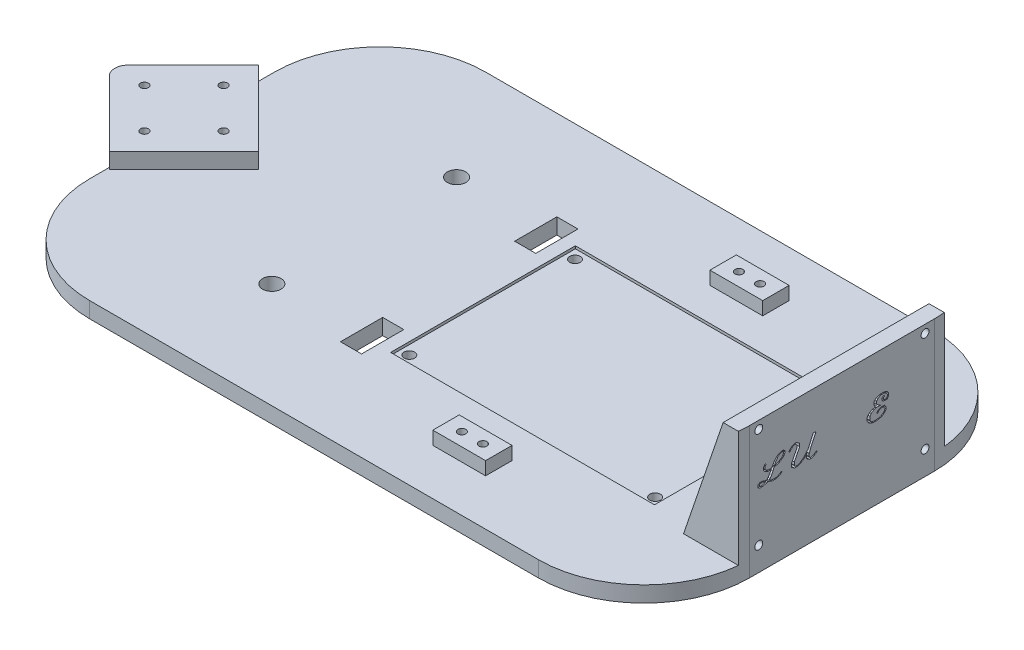
from build123d import *

# Parameters (mm, degrees)
SKETCH_1_W          = 250
SKETCH_1_H          = 150
EXTRUDE_1_DEPTH     = 6
SKETCH_2_W          = 78
SKETCH_2_H          = 44
EXTRUDE_2_DEPTH     = 6
SKETCH_3_W          = 15
SKETCH_3_H          = 70
CUT_EXTRUDE_2_DEPTH = 6
HOLE_WIZARD_M4_2_D  = 3
LOFT_START          = 36
LOFT_11_DEPTH       = 4
LOFT_START_2        = 110
LOFT_12_DEPTH       = 4
SKETCH_22_W         = 100
SKETCH_22_H         = 70
CUT_EXTRUDE_3_DEPTH = 1
HOLE_WIZARD_M5_1_D  = 4
HOLE_WIZARD_M8_1_D  = 7
SKETCH_30_W         = 20
SKETCH_30_H         = 10
EXTRUDE_3_DEPTH     = 5
SKETCH_31_R         = 1.5
CUT_EXTRUDE_4_DEPTH = 100
SKETCH_32_W         = 70
SKETCH_32_H         = 80
EXTRUDE_5_DEPTH     = 25
SKETCH_33_W         = 70
SKETCH_33_H         = 20
CUT_EXTRUDE_5_DEPTH = 65
LOFT_START_3        = 85
LOFT_13_DEPTH       = 10
SKETCH_43_W         = 8
SKETCH_43_H         = 16
CUT_EXTRUDE_6_DEPTH = 1000
EXTRUDE_6_DEPTH     = 6
SKETCH_46_R         = 1.5
CUT_EXTRUDE_7_DEPTH = 12
FILLET_1_R          = 40
FILLET_3_R          = 5
CUT_EXTRUDE_8_DEPTH = 2


# Read off the part's stored shape, not the designer's step: 放样11, 放样12, 放样13
with BuildPart() as part:
    # 草图1 → 凸台-拉伸1 (new body)
    with BuildSketch(Plane(origin=(0, 0, 0), x_dir=(1, 0, 0), z_dir=(0, 1, 0))):
        with Locations((125, -75)):
            Rectangle(SKETCH_1_W, SKETCH_1_H)
    extrude(amount=EXTRUDE_1_DEPTH)

    # 草图2 → 凸台-拉伸2 (add)
    with BuildSketch(Plane(origin=(250, 0, 0), x_dir=(0, 0, -1), z_dir=(1, 0, 0))):
        with Locations((-75, 28)):
            Rectangle(SKETCH_2_W, SKETCH_2_H)
    extrude(amount=-EXTRUDE_2_DEPTH)

    # 草图3 → 切除-拉伸2 (cut)
    with BuildSketch(Plane(origin=(0, 6, 0), x_dir=(1, 0, 0), z_dir=(0, 1, 0))):
        with Locations((236.5, -75)):
            Rectangle(SKETCH_3_W, SKETCH_3_H)
    extrude(amount=-CUT_EXTRUDE_2_DEPTH, mode=Mode.SUBTRACT)

    # M4 螺纹孔2 (through all)
    with Locations(Plane.ZY.offset(-244)):
        with Locations((43.5, 47), (43.5, 9), (106.5, 9), (106.5, 47)):
            Hole(HOLE_WIZARD_M4_2_D / 2)

    # 放样11 outline → 放样11 (add)
    with BuildSketch(Plane.XY.offset(LOFT_START)):
        Polygon((244, 6), (244, 50), (229, 6), align=None)
    extrude(amount=LOFT_11_DEPTH)

    # 放样12 outline → 放样12 (add)
    with BuildSketch(Plane.XY.offset(LOFT_START_2)):
        Polygon((244, 50), (229, 6), (244, 6), align=None)
    extrude(amount=LOFT_12_DEPTH)

    # 草图22 → 切除-拉伸3 (cut)
    with BuildSketch(Plane(origin=(0, 6, 0), x_dir=(1, 0, 0), z_dir=(0, 1, 0))):
        with Locations((164, -75)):
            Rectangle(SKETCH_22_W, SKETCH_22_H)
    extrude(amount=-CUT_EXTRUDE_3_DEPTH, mode=Mode.SUBTRACT)

    # M5 螺纹孔1 (through all)
    with Locations(Plane(origin=(0, 5, 0), x_dir=(1, 0, 0), z_dir=(0, 1, 0))):
        with Locations((117.39, -43.53), (210.34, -43.592), (117.423, -106.324), (210.599, -106.384)):
            Hole(HOLE_WIZARD_M5_1_D / 2)

    # M8 螺纹孔1 (through all)
    with Locations(Plane(origin=(0, 6, 0), x_dir=(1, 0, 0), z_dir=(0, 1, 0))):
        with Locations((69, -40), (69, -110)):
            Hole(HOLE_WIZARD_M8_1_D / 2)

    # 草图30 → 凸台-拉伸3 (add)
    with BuildSketch(Plane(origin=(0, 6, 0), x_dir=(1, 0, 0), z_dir=(0, 1, 0))):
        with Locations((162.5, -22.5)):
            Rectangle(SKETCH_30_W, SKETCH_30_H)
    extrude_3 = extrude(amount=EXTRUDE_3_DEPTH)

    # 草图31 → 切除-拉伸4 (cut)
    with BuildSketch(Plane(origin=(0, 11, 0), x_dir=(1, 0, 0), z_dir=(0, 1, 0))):
        with Locations(Location((158.5, -22.5, 0), (0, 0, 270))):
            Circle(SKETCH_31_R)
        with Locations(Location((166.5, -22.5, 0), (0, 0, 270))):
            Circle(SKETCH_31_R)
    cut_extrude_4 = extrude(amount=-CUT_EXTRUDE_4_DEPTH, mode=Mode.SUBTRACT)

    # 镜向1: 凸台-拉伸3, 切除-拉伸4 across plane
    add(extrude_3.mirror(Plane.XY.offset(75)))
    add(cut_extrude_4.mirror(Plane.XY.offset(75)), mode=Mode.SUBTRACT)

    # 草图32 → 凸台-拉伸5 (add)
    with BuildSketch(Plane.XZ):
        with Locations((169, 75)):
            Rectangle(SKETCH_32_W, SKETCH_32_H)
    extrude(amount=EXTRUDE_5_DEPTH)

    # 草图33 → 切除-拉伸5 (cut)
    with BuildSketch(Plane(origin=(204, 0, 0), x_dir=(0, 0, -1), z_dir=(1, 0, 0))):
        with Locations((-75, -10)):
            Rectangle(SKETCH_33_W, SKETCH_33_H)
    extrude(amount=-CUT_EXTRUDE_5_DEPTH, mode=Mode.SUBTRACT)

    # 放样13 outline → 放样13 (add)
    with BuildSketch(Plane.XY.offset(LOFT_START_3)):
        Polygon((109, 0), (134, -25), (134, 0), align=None)
    loft_13 = extrude(amount=LOFT_13_DEPTH)

    # 镜向2: 放样13 across plane
    add(loft_13.mirror(Plane.XY.offset(75)))

    # 草图43 → 切除-拉伸6 (cut)
    with BuildSketch(Plane.XZ):
        with Locations((105, 108)):
            Rectangle(SKETCH_43_W, SKETCH_43_H)
        with Locations((105, 42)):
            Rectangle(SKETCH_43_W, SKETCH_43_H)
    extrude(amount=-CUT_EXTRUDE_6_DEPTH, mode=Mode.SUBTRACT)

    # 草图44 → 凸台-拉伸6 (add, symmetric)
    with BuildSketch(Plane(origin=(0, 6, 0), x_dir=(1, 0, 0), z_dir=(0, 1, 0))):
        Polygon((-27.568542495, -75), (0.715728753, -46.715728753), (29, -75), (0.715728753, -103.284271247), align=None)
    extrude(amount=EXTRUDE_6_DEPTH, both=True)

    # 草图46 → 切除-拉伸7 (cut)
    with BuildSketch(Plane(origin=(0, 12, 0), x_dir=(1, 0, 0), z_dir=(0, 1, 0))):
        with Locations(Location((15.715728753, -75, 0), (0, 0, 270))):
            Circle(SKETCH_46_R)
        with Locations(Location((0.715728753, -90, 0), (0, 0, 270))):
            Circle(SKETCH_46_R)
        with Locations(Location((-14.284271247, -75, 0), (0, 0, 270))):
            Circle(SKETCH_46_R)
        with Locations(Location((0.715728753, -60, 0), (0, 0, 270))):
            Circle(SKETCH_46_R)
    extrude(amount=-CUT_EXTRUDE_7_DEPTH, mode=Mode.SUBTRACT)

    # 圆角1
    fillet_1_edges = [part.edges().sort_by_distance(p)[0] for p in [
        (250, 3, 0),
        (250, 3, 150),
        (0, 3, 150),
        (0, 3, 0),
    ]]
    fillet(fillet_1_edges, radius=FILLET_1_R)

    # 圆角3
    fillet_3_edges = [part.edges().sort_by_distance(p)[0] for p in [
        (171.5, -20, 40),
        (171.5, -20, 110),
        (169, -25, 35),
        (169, -25, 115),
        (-27.568542495, 6, 75),
    ]]
    fillet(fillet_3_edges, radius=FILLET_3_R)

    # 草图47 → 切除-拉伸8 (cut)
    # profile 1 of 3: a face of its own
    with BuildSketch(Plane(origin=(250, 0, 0), x_dir=(0, 0, -1), z_dir=(1, 0, 0))):
        Polygon((-96.528827614, 34.637996548), (-97.074559321, 33.480984353), (-97.579132492, 33.107508743), (-98.69346176, 32.320923377), (-99.798644687, 31.936777036), (-100.701083712, 31.721838011), (-101.141632492, 30.621228255), (-101.673644687, 29.511472158), (-102.207181273, 28.732508743), (-102.68888859, 28.430679475), (-101.365717858, 27.916959963), (-99.963278834, 27.916959963), (-99.009010541, 28.255374597), (-97.929742248, 28.987081914), (-97.579132492, 28.762996548), (-98.698034931, 27.953545328), (-99.830656882, 27.554155084), (-101.50596176, 27.554155084), (-103.015108102, 28.195923377), (-103.330656882, 27.945923377), (-104.967852004, 27.554155084), (-106.138583712, 27.554155084), (-106.783400785, 28.000801426), (-106.783400785, 28.868179475), (-106.135534931, 29.310252645), (-104.955656882, 29.310252645), (-103.608095907, 28.744703865), (-103.167547126, 29.234033133), (-102.650778834, 29.96421606), (-101.723949565, 31.517569719), (-103.041022736, 31.517569719), (-104.161449565, 31.921533133), (-104.739193468, 32.749277036), (-104.739193468, 33.58616728), (-104.138583712, 34.412386792), (-103.717852004, 34.255374597), (-104.210230053, 33.511472158), (-104.210230053, 32.825496548), (-103.771205663, 32.191350206), (-102.908400785, 31.881898987), (-101.583705663, 31.881898987), (-100.605047126, 33.634947767), (-99.556266639, 34.764520938), (-99.00596176, 35.163911182), (-97.912973956, 35.554155084), (-97.223949565, 35.554155084), (-96.528827614, 35.061777036), align=None)
        Polygon((-97.057791029, 34.642569719), (-97.057791029, 34.891045328), (-97.428217858, 35.15324045), (-97.787973956, 35.15324045), (-98.69346176, 34.831594109), (-99.13096176, 34.517569719), (-100.135534931, 33.121228255), (-100.594376395, 32.051106304), (-99.995291029, 32.241655084), (-99.00291298, 32.602935572), (-98.010534931, 33.305679475), (-97.530352004, 33.630374597), align=None, mode=Mode.SUBTRACT)
        Polygon((-103.81693737, 28.512996548), (-105.086754443, 29.003850206), (-105.926693468, 29.003850206), (-106.25443737, 28.767569719), (-106.25443737, 28.144094109), (-105.929742248, 27.915435572), (-105.077608102, 27.915435572), (-104.140108102, 28.240130694), align=None, mode=Mode.SUBTRACT)
    # profile 2 of 3: a face of its own
    with BuildSketch(Plane(origin=(250, 0, 0), x_dir=(0, 0, -1), z_dir=(1, 0, 0))):
        Polygon((-84.34041298, 28.762996548), (-85.444071517, 27.956594109), (-86.59193737, 27.554155084), (-87.302303224, 27.554155084), (-87.352608102, 27.607508743), (-88.457791029, 28.377325816), (-88.457791029, 29.573972158), (-88.136144687, 30.377325816), (-89.021815419, 29.08769167), (-90.613278834, 27.955069719), (-91.768766639, 27.554155084), (-92.979132492, 27.554155084), (-93.037059321, 27.602935572), (-94.116327614, 28.383423377), (-94.116327614, 29.58769167), (-92.067547126, 33.58769167), (-92.067547126, 34.59074045), (-92.494376395, 35.191350206), (-92.797730053, 35.191350206), (-93.686449565, 34.881898987), (-94.753522736, 33.781289231), (-95.125473956, 33.921533133), (-94.032486151, 35.154764841), (-92.922730053, 35.554155084), (-92.235230053, 35.554155084), (-90.994376395, 34.694398987), (-90.994376395, 33.545008743), (-93.043156882, 29.548057523), (-93.043156882, 28.488606304), (-92.634620297, 27.916959963), (-91.857181273, 27.916959963), (-90.8998642, 28.258423377), (-89.395291029, 29.313301426), (-87.884620297, 31.095313621), (-85.826693468, 35.503850206), (-85.21846176, 35.503850206), (-84.826693468, 35.394094109), (-86.870900785, 30.993179475), (-87.384620297, 29.545008743), (-87.384620297, 28.488606304), (-86.979132492, 27.916959963), (-86.71846176, 27.916959963), (-85.770291029, 28.255374597), (-84.686449565, 28.987081914), align=None)
    # profile 3 of 3: a face of its own
    with BuildSketch(Plane(origin=(250, 0, 0), x_dir=(0, 0, -1), z_dir=(1, 0, 0))):
        Polygon((-57.257791029, 33.519094109), (-57.862973956, 32.633423377), (-59.155656882, 32.633423377), (-59.794376395, 33.092264841), (-59.794376395, 33.988606304), (-59.125169078, 34.436777036), (-58.786754443, 34.209642889), (-59.26541298, 33.857508743), (-59.26541298, 33.229459963), (-58.939193468, 32.991655084), (-58.167852004, 32.991655084), (-57.744071517, 33.593789231), (-57.744071517, 34.224886792), (-58.195291029, 34.863606304), (-59.117547126, 35.189825816), (-60.478827614, 35.189825816), (-61.366022736, 34.549581914), (-61.843156882, 33.887996548), (-61.843156882, 32.862081914), (-60.937669078, 32.224886792), (-60.436144687, 31.897142889), (-62.071815419, 31.897142889), (-62.969681273, 31.572447767), (-63.908705663, 30.895618499), (-64.379742248, 30.232508743), (-64.379742248, 28.83769167), (-63.942242248, 28.206594109), (-63.07638859, 27.906289231), (-61.648034931, 27.906289231), (-60.187669078, 28.247752645), (-59.230352004, 28.933728255), (-58.76388859, 29.58769167), (-58.76388859, 30.206594109), (-59.181571517, 30.802630694), (-60.001693468, 30.802630694), (-60.869071517, 30.500801426), (-61.420900785, 29.756898987), (-61.821815419, 29.895618499), (-61.259315419, 30.762996548), (-60.132791029, 31.163911182), (-58.858400785, 31.163911182), (-58.234925175, 30.285862402), (-58.234925175, 29.516045328), (-58.786754443, 28.727935572), (-59.910230053, 27.944398987), (-61.564193468, 27.554155084), (-63.209010541, 27.554155084), (-64.295900785, 27.936777036), (-64.873644687, 28.33921606), (-65.45291298, 29.134947767), (-65.45291298, 30.331594109), (-64.904132492, 31.130374597), (-63.812669078, 31.897142889), (-62.216632492, 32.281289231), (-61.757791029, 32.281289231), (-62.338583712, 32.319398987), (-62.916327614, 33.133423377), (-62.916327614, 33.970313621), (-62.367547126, 34.769094109), (-61.798949565, 35.168484353), (-60.693766639, 35.554155084), (-59.032181273, 35.554155084), (-57.834010541, 35.127325816), (-57.257791029, 34.299581914), align=None)
    extrude(amount=-CUT_EXTRUDE_8_DEPTH, mode=Mode.SUBTRACT)


solid = part.part
